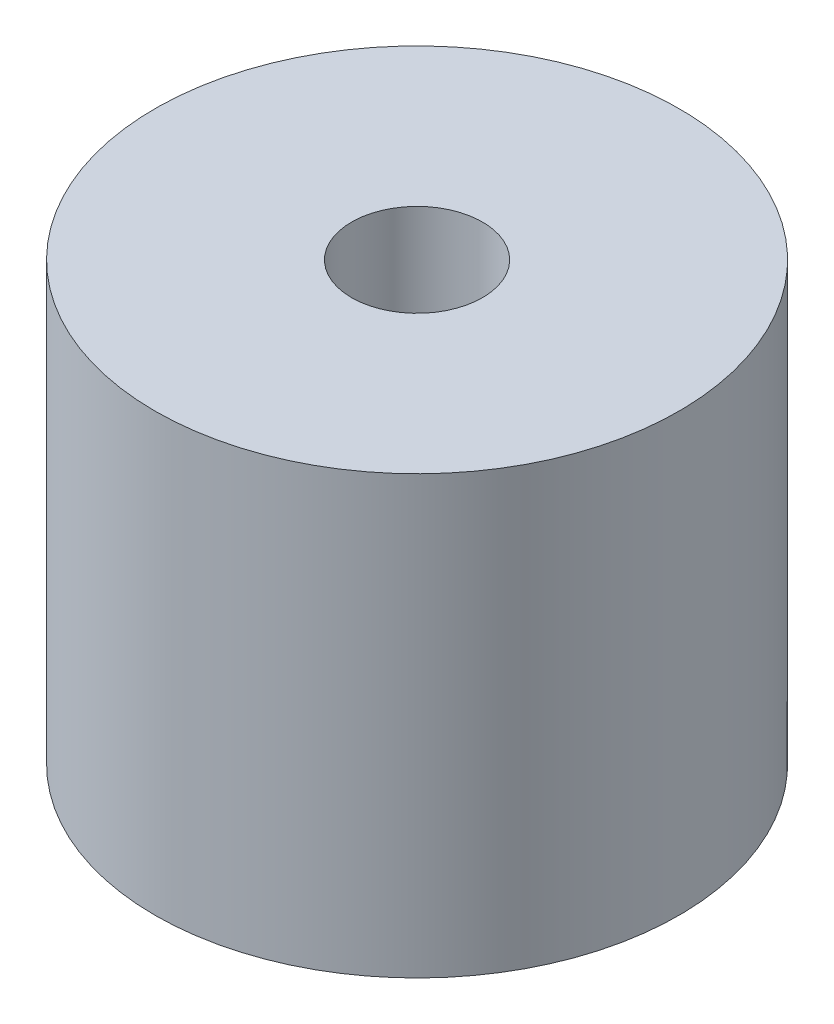
from build123d import *

# Parameters (mm, degrees)
SKETCH1_R           = 3
BOSS_EXTRUDE1_DEPTH = 5
SKETCH2_R           = 0.75
CUT_EXTRUDE1_DEPTH  = 7.557438524


with BuildPart() as part:
    # Sketch1 → Boss-Extrude1 (new body)
    with BuildSketch(Plane(origin=(0, 0, 0), x_dir=(1, 0, 0), z_dir=(0, 1, 0))):
        Circle(SKETCH1_R)
    extrude(amount=BOSS_EXTRUDE1_DEPTH)

    # Sketch2 → Cut-Extrude1 (cut, through all)
    with BuildSketch(Plane(origin=(0, 5, 0), x_dir=(1, 0, 0), z_dir=(0, 1, 0))):
        Circle(SKETCH2_R)
    extrude(amount=-CUT_EXTRUDE1_DEPTH, mode=Mode.SUBTRACT)


solid = part.part
